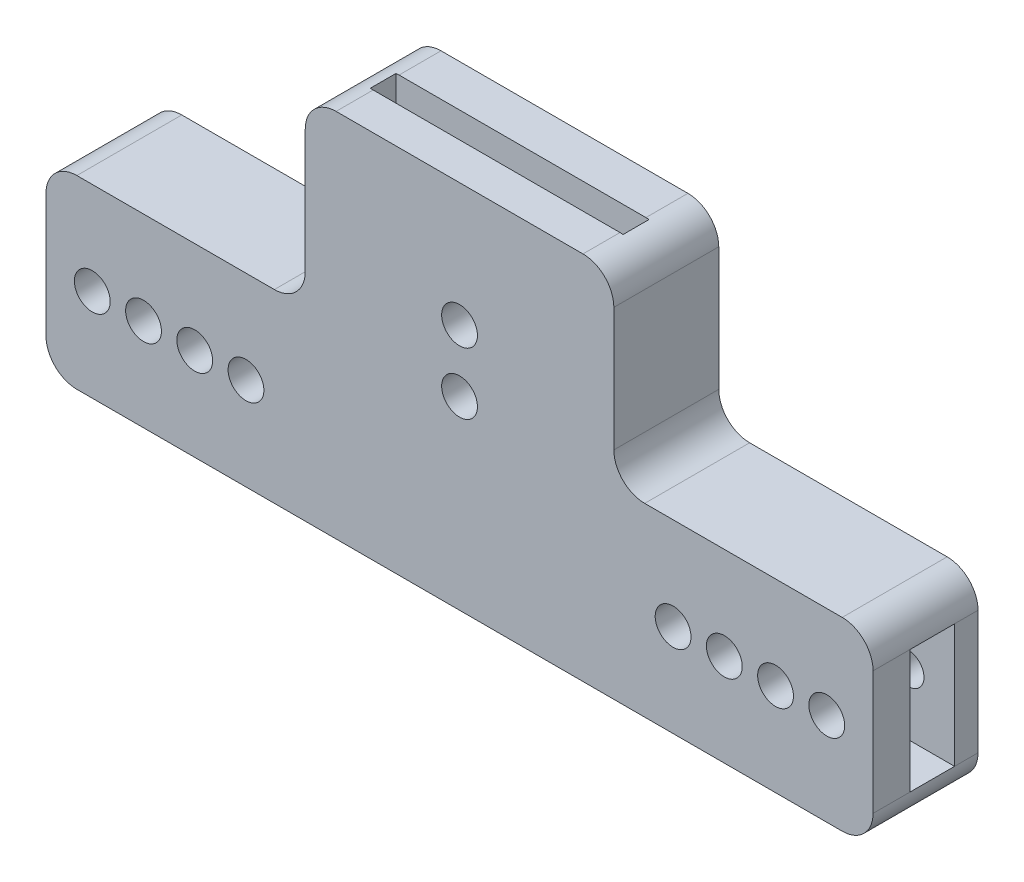
from build123d import *
from build123d.topology import SkipClean

# Parameters (mm, degrees)
SKETCH1_W           = 50
SKETCH1_H           = 60
BOSS_EXTRUDE1_DEPTH = 12
SKETCH2_W           = 41
SKETCH2_H           = 4.2
CUT_EXTRUDE1_DEPTH  = 67.098411479
SKETCH3_W           = 12
SKETCH3_H           = 30
BOSS_EXTRUDE2_DEPTH = 42
SKETCH4_W           = 7.2
SKETCH4_H           = 20
CUT_EXTRUDE2_DEPTH  = 42.5
SKETCH5_R           = 2.55
CUT_EXTRUDE3_DEPTH  = 35
FILLET1_R           = 5
SKETCH6_R           = 2.55
CUT_EXTRUDE4_DEPTH  = 35
SKETCH7_R           = 2.9
BOSS_EXTRUDE3_DEPTH = 5


with BuildPart() as part:
    # Sketch1 → Boss-Extrude1 (new body)
    with BuildSketch(Plane.XY):
        Rectangle(SKETCH1_W, SKETCH1_H)
    extrude(amount=BOSS_EXTRUDE1_DEPTH)

    # Sketch2 → Cut-Extrude1 (cut, through all)
    with BuildSketch(Plane(origin=(0, 30, 0), x_dir=(1, 0, 0), z_dir=(0, 1, 0))):
        with Locations((0, -8.9)):
            Rectangle(SKETCH2_W, SKETCH2_H)
    extrude(amount=-CUT_EXTRUDE1_DEPTH, mode=Mode.SUBTRACT)

    # Sketch3 → Boss-Extrude2 (add)
    with BuildSketch(Plane.ZY.offset(25)):
        with Locations((6, -15)):
            Rectangle(SKETCH3_W, SKETCH3_H)
    boss_extrude2 = extrude(amount=BOSS_EXTRUDE2_DEPTH)

    # Sketch4 → Cut-Extrude2 (cut)
    with BuildSketch(Plane.ZY.offset(67)):
        with Locations((7.4, -15)):
            Rectangle(SKETCH4_W, SKETCH4_H)
    cut_extrude2 = extrude(amount=-CUT_EXTRUDE2_DEPTH, mode=Mode.SUBTRACT)

    # Sketch5 → Cut-Extrude3 (cut)
    with BuildSketch(Plane.XY.offset(12)):
        with Locations((-59.5, -14.995756269)):
            Circle(SKETCH5_R)
        with Locations((-51.2, -14.995756269)):
            Circle(SKETCH5_R)
        with Locations((-42.9, -14.995756269)):
            Circle(SKETCH5_R)
        with Locations((-34.6, -14.995756269)):
            Circle(SKETCH5_R)
    cut_extrude3 = extrude(amount=-CUT_EXTRUDE3_DEPTH, mode=Mode.SUBTRACT)

    # Mirror1: Boss-Extrude2, Cut-Extrude2, Cut-Extrude3 across plane
    add(boss_extrude2.mirror(Plane(origin=(0, 0, 0), x_dir=(0, 0, 1), z_dir=(1, 0, 0))))
    add(cut_extrude2.mirror(Plane(origin=(0, 0, 0), x_dir=(0, 0, 1), z_dir=(1, 0, 0))), mode=Mode.SUBTRACT)
    add(cut_extrude3.mirror(Plane(origin=(0, 0, 0), x_dir=(0, 0, 1), z_dir=(1, 0, 0))), mode=Mode.SUBTRACT)

    # Fillet1
    # the kernel refuses this fillet: 5 mm, written as the material it adds along each edge
    with BuildSketch(Plane(origin=(25, 0, 12), x_dir=(0, 1, 0), z_dir=(0, 0, -1))) as fillet1_piece_1:
        with BuildLine():
            CenterArc((FILLET1_R, FILLET1_R), FILLET1_R, 180, 90)
            Line((0, FILLET1_R), (0, 0))
            Line((0, 0), (FILLET1_R, 0))
        make_face()
    extrude(amount=12)
    with BuildSketch(Plane(origin=(-25, 0, 12), x_dir=(0, 1, 0), z_dir=(0, 0, -1))) as fillet1_piece_2:
        with BuildLine():
            CenterArc((FILLET1_R, -FILLET1_R), FILLET1_R, 90, 90)
            Line((0, -FILLET1_R), (0, 0))
            Line((0, 0), (FILLET1_R, 0))
        make_face()
    extrude(amount=12)
    # the kernel refuses this fillet: 5 mm, written as the material it takes off along each edge
    with BuildSketch(Plane(origin=(67, -30, -12.5), x_dir=(0, 1, 0), z_dir=(0, 0, 1)), Plane(origin=(-67, 0, 24.5), x_dir=(1, 0, 0), z_dir=(0, 0, -1)), Plane(origin=(25, 30, -12.5), x_dir=(-1, 0, 0), z_dir=(0, 0, 1))) as fillet1_2_piece_1:
        with BuildLine():
            CenterArc((FILLET1_R, FILLET1_R), FILLET1_R, 180, 90)
            Line((0, FILLET1_R), (0, 0))
            Line((0, 0), (FILLET1_R, 0))
        make_face()
    extrude(amount=37, mode=Mode.SUBTRACT)
    with BuildSketch(Plane(origin=(67, 0, 24.5), x_dir=(-1, 0, 0), z_dir=(0, 0, -1)), Plane(origin=(-67, -30, -12.5), x_dir=(0, 1, 0), z_dir=(0, 0, 1)), Plane(origin=(-25, 30, -12.5), x_dir=(1, 0, 0), z_dir=(0, 0, 1))) as fillet1_2_piece_2:
        with BuildLine():
            CenterArc((FILLET1_R, -FILLET1_R), FILLET1_R, 90, 90)
            Line((0, -FILLET1_R), (0, 0))
            Line((0, 0), (FILLET1_R, 0))
        make_face()
    extrude(amount=37, mode=Mode.SUBTRACT)

    # Sketch6 → Cut-Extrude4 (cut)
    with BuildSketch(Plane.XY.offset(12)):
        Circle(SKETCH6_R)
        with Locations((0, 10)):
            Circle(SKETCH6_R)
    extrude(amount=-CUT_EXTRUDE4_DEPTH, mode=Mode.SUBTRACT)

    # Sketch7 → Boss-Extrude3 (add)
    with SkipClean():  # the faces are left unmerged after this step: merging them gives an invalid solid
        with BuildSketch(Plane.XY.offset(12)):
            with BuildLine():
                ThreePointArc((-67, -25), (-65.535533906, -28.535533906), (-62, -30))
                Line((-62, -30), (62, -30))
                ThreePointArc((62, -30), (65.535533906, -28.535533906), (67, -25))
                Line((67, -25), (67, -5))
                ThreePointArc((67, -5), (65.535533906, -1.464466094), (62, 0))
                Line((62, 0), (30, 0))
                ThreePointArc((30, 0), (26.464466094, 1.464466094), (25, 5))
                Line((25, 5), (25, 25))
                ThreePointArc((25, 25), (23.535533906, 28.535533906), (20, 30))
                Line((20, 30), (-20, 30))
                ThreePointArc((-20, 30), (-23.535533906, 28.535533906), (-25, 25))
                Line((-25, 25), (-25, 5))
                ThreePointArc((-25, 5), (-26.464466094, 1.464466094), (-30, 0))
                Line((-30, 0), (-62, 0))
                ThreePointArc((-62, 0), (-65.535533906, -1.464466094), (-67, -5))
                Line((-67, -5), (-67, -25))
            make_face()
            with Locations((-59.5, -14.995756269)):
                Circle(SKETCH7_R, mode=Mode.SUBTRACT)
            with Locations((-51.2, -14.995756269)):
                Circle(SKETCH7_R, mode=Mode.SUBTRACT)
            with Locations((-42.9, -14.995756269)):
                Circle(SKETCH7_R, mode=Mode.SUBTRACT)
            with Locations((-34.6, -14.995756269)):
                Circle(SKETCH7_R, mode=Mode.SUBTRACT)
            with Locations((59.5, -14.995756269)):
                Circle(SKETCH7_R, mode=Mode.SUBTRACT)
            with Locations((51.2, -14.995756269)):
                Circle(SKETCH7_R, mode=Mode.SUBTRACT)
            with Locations((42.9, -14.995756269)):
                Circle(SKETCH7_R, mode=Mode.SUBTRACT)
            with Locations((34.6, -14.995756269)):
                Circle(SKETCH7_R, mode=Mode.SUBTRACT)
            with Locations((0, 10)):
                Circle(SKETCH7_R, mode=Mode.SUBTRACT)
            Circle(SKETCH7_R, mode=Mode.SUBTRACT)
        extrude(amount=BOSS_EXTRUDE3_DEPTH)


solid = part.part
